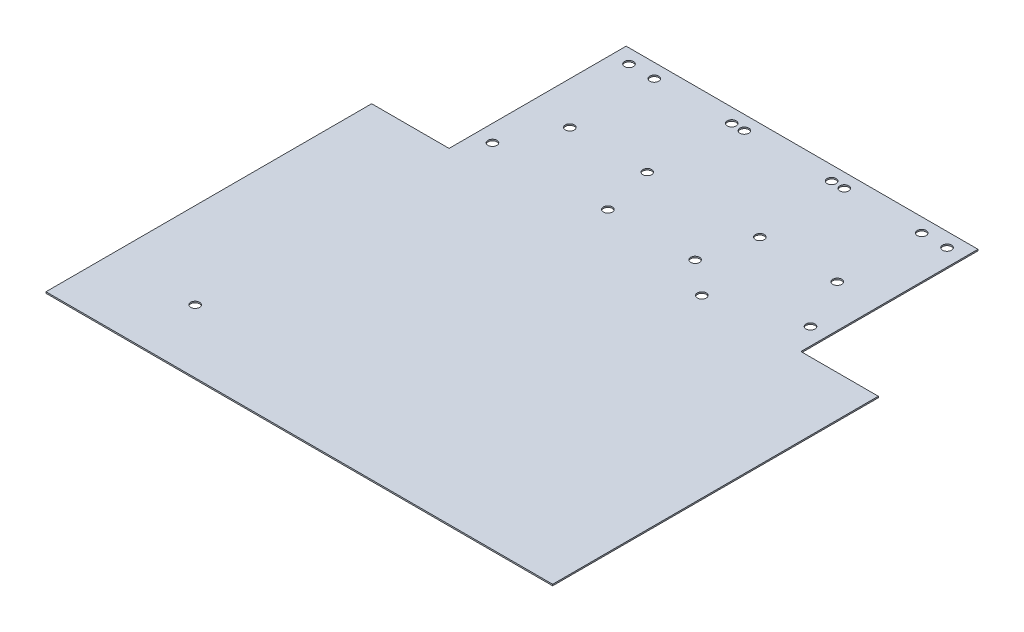
from build123d import *

# Parameters (mm, degrees)
SALIENTE_EXTRUIR1_DEPTH = 0.5
CORTAR_EXTRUIR1_REACH   = 202.939
CORTAR_EXTRUIR3_REACH   = 128.793
CROQUIS5_R              = 1.585
CORTAR_EXTRUIR4_REACH   = 128.793
CROQUIS6_R              = 1.585
CORTAR_EXTRUIR5_REACH   = 128.793
CROQUIS7_R              = 1.585
CORTAR_EXTRUIR6_REACH   = 128.793
CROQUIS8_R              = 1.585
CORTAR_EXTRUIR7_REACH   = 128.793
CROQUIS9_R              = 1.585
CORTAR_EXTRUIR8_REACH   = 128.793
CROQUIS10_R             = 1.585


with BuildPart() as part:
    # Croquis2 → Saliente-Extruir1 (new body)
    with BuildSketch(Plane(origin=(0, 0, 0), x_dir=(1, 0, 0), z_dir=(0, 1, 0))):
        Polygon((-90, 26.39), (-62.5, 26.39), (-62.5, 89.31), (62.5, 89.31), (62.5, 26.39), (90, 26.39), (90, -89.31), (-90, -89.31), align=None)
    saliente_extruir1 = extrude(amount=SALIENTE_EXTRUIR1_DEPTH)

    # Croquis3 → Cortar-Extruir1 (cut, up to next)
    with BuildSketch(Plane(origin=(90, 0, 0), x_dir=(0, 0, -1), z_dir=(1, 0, 0)), mode=Mode.PRIVATE) as cortar_extruir1_sk1:
        Polygon((-89.31, 0), (-87.93626129, 0.5), (-89.31, 0.5), align=None)
    cortar_extruir1_tool1 = extrude(cortar_extruir1_sk1.sketch, amount=-CORTAR_EXTRUIR1_REACH, mode=Mode.PRIVATE) & part.part
    add(cortar_extruir1_tool1.solids().sort_by_distance((90, 0.333333, 88.852087))[0], mode=Mode.SUBTRACT)

    # Croquis5 → Cortar-Extruir3 (cut, up to next)
    with BuildSketch(Plane(origin=(0, 0.5, 0), x_dir=(1, 0, 0), z_dir=(0, 1, 0)), mode=Mode.PRIVATE) as cortar_extruir3_sk1:
        with Locations((74, -24.974980583)):
            Circle(CROQUIS5_R)
    cortar_extruir3_tool1 = extrude(cortar_extruir3_sk1.sketch, amount=-CORTAR_EXTRUIR3_REACH, mode=Mode.PRIVATE) & part.part
    cortar_extruir3 = cortar_extruir3_tool1.solids().sort_by_distance((74, 0.5, 24.974981))[0]
    add(cortar_extruir3, mode=Mode.SUBTRACT)

    # Simetría1: Cortar-Extruir3 across plane
    add(cortar_extruir3.mirror(Plane(origin=(0, 0, 0), x_dir=(0, 0, 1), z_dir=(1, 0, 0))), mode=Mode.SUBTRACT)

    # Croquis6 → Cortar-Extruir4 (cut, up to next)
    with BuildSketch(Plane(origin=(0, 0.5, 0), x_dir=(1, 0, 0), z_dir=(0, 1, 0)), mode=Mode.PRIVATE) as cortar_extruir4_sk1:
        with Locations((-56.5, 35.81)):
            Circle(CROQUIS6_R)
    cortar_extruir4_tool1 = extrude(cortar_extruir4_sk1.sketch, amount=-CORTAR_EXTRUIR4_REACH, mode=Mode.PRIVATE) & part.part
    # Croquis6 → Cortar-Extruir4 (cut, up to next)
    with BuildSketch(Plane(origin=(0, 0.5, 0), x_dir=(1, 0, 0), z_dir=(0, 1, 0)), mode=Mode.PRIVATE) as cortar_extruir4_sk2:
        with Locations((-15.5, 35.81)):
            Circle(CROQUIS6_R)
    cortar_extruir4_tool2 = extrude(cortar_extruir4_sk2.sketch, amount=-CORTAR_EXTRUIR4_REACH, mode=Mode.PRIVATE) & part.part
    # Croquis6 → Cortar-Extruir4 (cut, up to next)
    with BuildSketch(Plane(origin=(0, 0.5, 0), x_dir=(1, 0, 0), z_dir=(0, 1, 0)), mode=Mode.PRIVATE) as cortar_extruir4_sk3:
        with Locations((-15.5, 84.31)):
            Circle(CROQUIS6_R)
    cortar_extruir4_tool3 = extrude(cortar_extruir4_sk3.sketch, amount=-CORTAR_EXTRUIR4_REACH, mode=Mode.PRIVATE) & part.part
    # Croquis6 → Cortar-Extruir4 (cut, up to next)
    with BuildSketch(Plane(origin=(0, 0.5, 0), x_dir=(1, 0, 0), z_dir=(0, 1, 0)), mode=Mode.PRIVATE) as cortar_extruir4_sk4:
        with Locations((-56.5, 84.31)):
            Circle(CROQUIS6_R)
    cortar_extruir4_tool4 = extrude(cortar_extruir4_sk4.sketch, amount=-CORTAR_EXTRUIR4_REACH, mode=Mode.PRIVATE) & part.part
    add(cortar_extruir4_tool1.solids().sort_by_distance((-56.5, 0.5, -35.81))[0], mode=Mode.SUBTRACT)
    add(cortar_extruir4_tool2.solids().sort_by_distance((-15.5, 0.5, -35.81))[0], mode=Mode.SUBTRACT)
    add(cortar_extruir4_tool3.solids().sort_by_distance((-15.5, 0.5, -84.31))[0], mode=Mode.SUBTRACT)
    add(cortar_extruir4_tool4.solids().sort_by_distance((-56.5, 0.5, -84.31))[0], mode=Mode.SUBTRACT)

    # Croquis7 → Cortar-Extruir5 (cut, up to next)
    with BuildSketch(Plane(origin=(0, 0.5, 0), x_dir=(1, 0, 0), z_dir=(0, 1, 0)), mode=Mode.PRIVATE) as cortar_extruir5_sk1:
        with Locations((56.5, 35.81)):
            Circle(CROQUIS7_R)
    cortar_extruir5_tool1 = extrude(cortar_extruir5_sk1.sketch, amount=-CORTAR_EXTRUIR5_REACH, mode=Mode.PRIVATE) & part.part
    # Croquis7 → Cortar-Extruir5 (cut, up to next)
    with BuildSketch(Plane(origin=(0, 0.5, 0), x_dir=(1, 0, 0), z_dir=(0, 1, 0)), mode=Mode.PRIVATE) as cortar_extruir5_sk2:
        with Locations((15.5, 35.81)):
            Circle(CROQUIS7_R)
    cortar_extruir5_tool2 = extrude(cortar_extruir5_sk2.sketch, amount=-CORTAR_EXTRUIR5_REACH, mode=Mode.PRIVATE) & part.part
    # Croquis7 → Cortar-Extruir5 (cut, up to next)
    with BuildSketch(Plane(origin=(0, 0.5, 0), x_dir=(1, 0, 0), z_dir=(0, 1, 0)), mode=Mode.PRIVATE) as cortar_extruir5_sk3:
        with Locations((15.5, 84.31)):
            Circle(CROQUIS7_R)
    cortar_extruir5_tool3 = extrude(cortar_extruir5_sk3.sketch, amount=-CORTAR_EXTRUIR5_REACH, mode=Mode.PRIVATE) & part.part
    # Croquis7 → Cortar-Extruir5 (cut, up to next)
    with BuildSketch(Plane(origin=(0, 0.5, 0), x_dir=(1, 0, 0), z_dir=(0, 1, 0)), mode=Mode.PRIVATE) as cortar_extruir5_sk4:
        with Locations((56.5, 84.31)):
            Circle(CROQUIS7_R)
    cortar_extruir5_tool4 = extrude(cortar_extruir5_sk4.sketch, amount=-CORTAR_EXTRUIR5_REACH, mode=Mode.PRIVATE) & part.part
    add(cortar_extruir5_tool1.solids().sort_by_distance((56.5, 0.5, -35.81))[0], mode=Mode.SUBTRACT)
    add(cortar_extruir5_tool2.solids().sort_by_distance((15.5, 0.5, -35.81))[0], mode=Mode.SUBTRACT)
    add(cortar_extruir5_tool3.solids().sort_by_distance((15.5, 0.5, -84.31))[0], mode=Mode.SUBTRACT)
    add(cortar_extruir5_tool4.solids().sort_by_distance((56.5, 0.5, -84.31))[0], mode=Mode.SUBTRACT)

    # Simetría3: Saliente-Extruir1 across plane
    add(saliente_extruir1.mirror(Plane(origin=(0, 0, 0), x_dir=(0, 0, 1), z_dir=(1, 0, 0))))

    # Croquis8 → Cortar-Extruir6 (cut, up to next)
    with BuildSketch(Plane(origin=(0, 0.5, 0), x_dir=(1, 0, 0), z_dir=(0, 1, 0)), mode=Mode.PRIVATE) as cortar_extruir6_sk1:
        with Locations((-20, 54.31)):
            Circle(CROQUIS8_R)
    cortar_extruir6_tool1 = extrude(cortar_extruir6_sk1.sketch, amount=-CORTAR_EXTRUIR6_REACH, mode=Mode.PRIVATE) & part.part
    # Croquis8 → Cortar-Extruir6 (cut, up to next)
    with BuildSketch(Plane(origin=(0, 0.5, 0), x_dir=(1, 0, 0), z_dir=(0, 1, 0)), mode=Mode.PRIVATE) as cortar_extruir6_sk2:
        with Locations((-47.5, 54.31)):
            Circle(CROQUIS8_R)
    cortar_extruir6_tool2 = extrude(cortar_extruir6_sk2.sketch, amount=-CORTAR_EXTRUIR6_REACH, mode=Mode.PRIVATE) & part.part
    # Croquis8 → Cortar-Extruir6 (cut, up to next)
    with BuildSketch(Plane(origin=(0, 0.5, 0), x_dir=(1, 0, 0), z_dir=(0, 1, 0)), mode=Mode.PRIVATE) as cortar_extruir6_sk3:
        with Locations((-47.5, 84.31)):
            Circle(CROQUIS8_R)
    cortar_extruir6_tool3 = extrude(cortar_extruir6_sk3.sketch, amount=-CORTAR_EXTRUIR6_REACH, mode=Mode.PRIVATE) & part.part
    # Croquis8 → Cortar-Extruir6 (cut, up to next)
    with BuildSketch(Plane(origin=(0, 0.5, 0), x_dir=(1, 0, 0), z_dir=(0, 1, 0)), mode=Mode.PRIVATE) as cortar_extruir6_sk4:
        with Locations((-20, 84.31)):
            Circle(CROQUIS8_R)
    cortar_extruir6_tool4 = extrude(cortar_extruir6_sk4.sketch, amount=-CORTAR_EXTRUIR6_REACH, mode=Mode.PRIVATE) & part.part
    cortar_extruir6_1 = cortar_extruir6_tool1.solids().sort_by_distance((-20, 0.5, -54.31))[0]
    add(cortar_extruir6_1, mode=Mode.SUBTRACT)
    cortar_extruir6_2 = cortar_extruir6_tool2.solids().sort_by_distance((-47.5, 0.5, -54.31))[0]
    add(cortar_extruir6_2, mode=Mode.SUBTRACT)
    cortar_extruir6_3 = cortar_extruir6_tool3.solids().sort_by_distance((-47.5, 0.5, -84.31))[0]
    add(cortar_extruir6_3, mode=Mode.SUBTRACT)
    cortar_extruir6_4 = cortar_extruir6_tool4.solids().sort_by_distance((-20, 0.5, -84.31))[0]
    add(cortar_extruir6_4, mode=Mode.SUBTRACT)
    cortar_extruir6 = cortar_extruir6_1 + cortar_extruir6_2 + cortar_extruir6_3 + cortar_extruir6_4  # Cortar-Extruir6 as one shape, for the pattern or mirror that repeats it

    # Simetría4: Cortar-Extruir6 across plane
    add(cortar_extruir6.mirror(Plane(origin=(0, 0, 0), x_dir=(0, 0, 1), z_dir=(1, 0, 0))), mode=Mode.SUBTRACT)

    # Croquis9 → Cortar-Extruir7 (cut, up to next)
    with BuildSketch(Plane.XZ, mode=Mode.PRIVATE) as cortar_extruir7_sk1:
        with Locations((56.5, -35.81)):
            Circle(CROQUIS9_R)
    cortar_extruir7_tool1 = extrude(cortar_extruir7_sk1.sketch, amount=-CORTAR_EXTRUIR7_REACH, mode=Mode.PRIVATE) & part.part
    # Croquis9 → Cortar-Extruir7 (cut, up to next)
    with BuildSketch(Plane.XZ, mode=Mode.PRIVATE) as cortar_extruir7_sk2:
        with Locations((15.5, -35.81)):
            Circle(CROQUIS9_R)
    cortar_extruir7_tool2 = extrude(cortar_extruir7_sk2.sketch, amount=-CORTAR_EXTRUIR7_REACH, mode=Mode.PRIVATE) & part.part
    # Croquis9 → Cortar-Extruir7 (cut, up to next)
    with BuildSketch(Plane.XZ, mode=Mode.PRIVATE) as cortar_extruir7_sk3:
        with Locations((15.5, -84.31)):
            Circle(CROQUIS9_R)
    cortar_extruir7_tool3 = extrude(cortar_extruir7_sk3.sketch, amount=-CORTAR_EXTRUIR7_REACH, mode=Mode.PRIVATE) & part.part
    # Croquis9 → Cortar-Extruir7 (cut, up to next)
    with BuildSketch(Plane.XZ, mode=Mode.PRIVATE) as cortar_extruir7_sk4:
        with Locations((56.5, -84.31)):
            Circle(CROQUIS9_R)
    cortar_extruir7_tool4 = extrude(cortar_extruir7_sk4.sketch, amount=-CORTAR_EXTRUIR7_REACH, mode=Mode.PRIVATE) & part.part
    cortar_extruir7_1 = cortar_extruir7_tool1.solids().sort_by_distance((56.5, 0, -35.81))[0]
    add(cortar_extruir7_1, mode=Mode.SUBTRACT)
    cortar_extruir7_2 = cortar_extruir7_tool2.solids().sort_by_distance((15.5, 0, -35.81))[0]
    add(cortar_extruir7_2, mode=Mode.SUBTRACT)
    cortar_extruir7_3 = cortar_extruir7_tool3.solids().sort_by_distance((15.5, 0, -84.31))[0]
    add(cortar_extruir7_3, mode=Mode.SUBTRACT)
    cortar_extruir7_4 = cortar_extruir7_tool4.solids().sort_by_distance((56.5, 0, -84.31))[0]
    add(cortar_extruir7_4, mode=Mode.SUBTRACT)
    cortar_extruir7 = cortar_extruir7_1 + cortar_extruir7_2 + cortar_extruir7_3 + cortar_extruir7_4  # Cortar-Extruir7 as one shape, for the pattern or mirror that repeats it

    # Simetría5: Cortar-Extruir7 across plane
    add(cortar_extruir7.mirror(Plane(origin=(0, 0, 0), x_dir=(0, 0, 1), z_dir=(1, 0, 0))), mode=Mode.SUBTRACT)

    # Croquis10 → Cortar-Extruir8 (cut, up to next)
    with BuildSketch(Plane(origin=(0, 0.5, 0), x_dir=(1, 0, 0), z_dir=(0, 1, 0)), mode=Mode.PRIVATE) as cortar_extruir8_sk1:
        with Locations((27.640844058, 26.042512926)):
            Circle(CROQUIS10_R)
    cortar_extruir8_tool1 = extrude(cortar_extruir8_sk1.sketch, amount=-CORTAR_EXTRUIR8_REACH, mode=Mode.PRIVATE) & part.part
    # Croquis10 → Cortar-Extruir8 (cut, up to next)
    with BuildSketch(Plane(origin=(0, 0.5, 0), x_dir=(1, 0, 0), z_dir=(0, 1, 0)), mode=Mode.PRIVATE) as cortar_extruir8_sk2:
        with Locations((-59.479155942, -66.837487074)):
            Circle(CROQUIS10_R)
    cortar_extruir8_tool2 = extrude(cortar_extruir8_sk2.sketch, amount=-CORTAR_EXTRUIR8_REACH, mode=Mode.PRIVATE) & part.part
    add(cortar_extruir8_tool1.solids().sort_by_distance((27.640844, 0.5, -26.042513))[0], mode=Mode.SUBTRACT)
    add(cortar_extruir8_tool2.solids().sort_by_distance((-59.479156, 0.5, 66.837487))[0], mode=Mode.SUBTRACT)


solid = part.part
